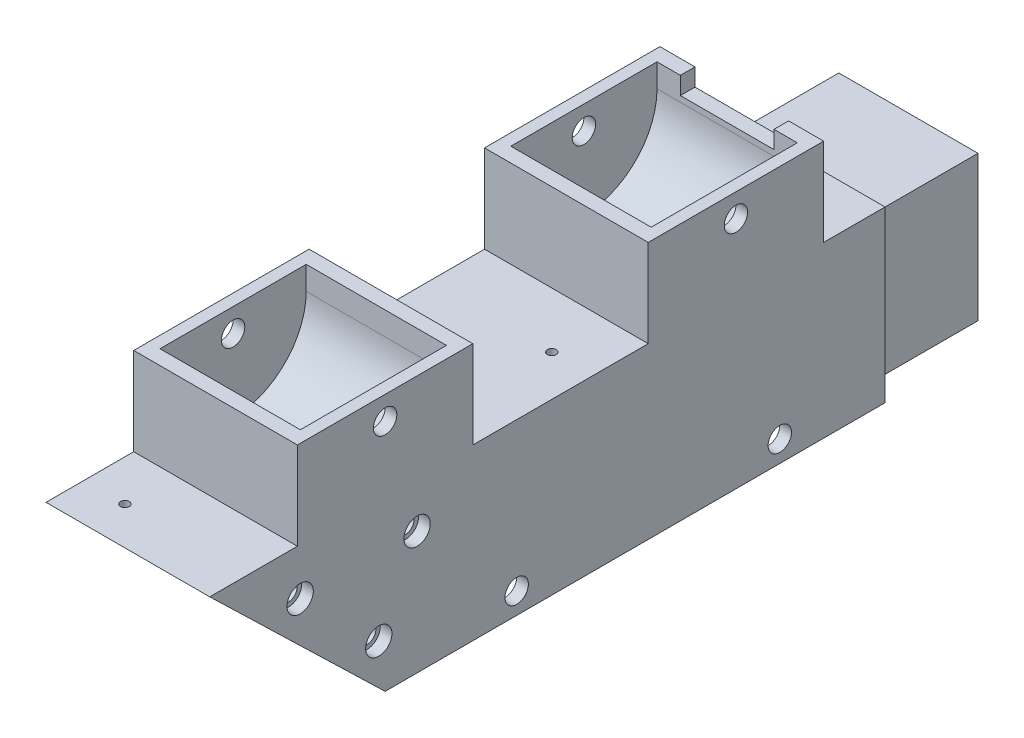
from build123d import *

# Parameters (mm, degrees)
SKETCH_1_W           = 250
SKETCH_1_H           = 29
SKETCH_1_W_2         = 30
SKETCH_1_H_2         = 15
EXTRUDE_1_DEPTH      = 28
SKETCH_1_3_R         = 2
CUT_EXTRUDE_1_DEPTH  = 132.450561049
CUT_EXTRUDE_START    = 2
SKETCH_1_5_R         = 2
CUT_EXTRUDE_2_DEPTH  = 24
SKETCH_3_W           = 6
SKETCH_3_H           = 19
EXTRUDE_2_DEPTH      = 35
SKETCH_3_3_W         = 6
SKETCH_3_3_H         = 19
EXTRUDE_3_DEPTH      = 35
SKETCH_1_6_R         = 2
CUT_EXTRUDE_3_DEPTH  = 166.088612569
CUT_EXTRUDE_7_REACH  = 167.089
SKETCH_1_8_R         = 3.1
FILLET_1_R           = 9.5
FILLET_2_R           = 5
SKETCH_4_R           = 5.1
CUT_EXTRUDE_4_DEPTH  = 31.5
SKETCH_4_2_OUTSIDE_W = 87.946
SKETCH_4_2_OUTSIDE_H = 103.946
SKETCH_4_2_OUTSIDE_R = 5.1
CUT_EXTRUDE_5_DEPTH  = 21.5
SKETCH_5_OUTSIDE_W   = 83.722
SKETCH_5_OUTSIDE_H   = 99.722
SKETCH_5_OUTSIDE_W_2 = 23.8
SKETCH_5_OUTSIDE_H_2 = 24.8
CUT_EXTRUDE_6_DEPTH  = 18
SKETCH_6_R           = 0.75
CUT_EXTRUDE_8_DEPTH  = 4
SKETCH_7_R           = 0.75
CUT_EXTRUDE_9_DEPTH  = 4
SKETCH_8_R           = 0.75
CUT_EXTRUDE_10_DEPTH = 4
SKETCH_9_R           = 0.75
CUT_EXTRUDE_11_DEPTH = 4
SKETCH_11_R          = 0.75
CUT_EXTRUDE_12_DEPTH = 166.088612569
CUT_EXTRUDE_13_DEPTH = 166.088612569
CUT_EXTRUDE_START_2  = 30
SKETCH_13_W          = 20.2
SKETCH_13_H          = 21.2
CUT_EXTRUDE_14_DEPTH = 40
SKETCH_11_5_R        = 1.5
CUT_EXTRUDE_18_DEPTH = 112.204766085
SKETCH_11_6_R        = 2.25
CUT_EXTRUDE_19_DEPTH = 2
CUT_EXTRUDE_START_3  = 26
SKETCH_11_7_R        = 2.25
CUT_EXTRUDE_20_DEPTH = 2
SKETCH_15_W          = 16
SKETCH_15_H          = 2.5
SKETCH_15_H_2        = 10
CUT_EXTRUDE_21_DEPTH = 3


with BuildPart() as part:
    # 草图1 → 凸台-拉伸1 (new body)
    with BuildSketch(Plane(origin=(0, 0, 0), x_dir=(0, 0, -1), z_dir=(1, 0, 0))):
        Rectangle(SKETCH_1_W, SKETCH_1_H)
        with Locations((-60, 22)):
            Rectangle(SKETCH_1_W_2, SKETCH_1_H_2)
        with Locations((0, 22)):
            Rectangle(SKETCH_1_W_2, SKETCH_1_H_2)
        with Locations((60, 22)):
            Rectangle(SKETCH_1_W_2, SKETCH_1_H_2)
    extrude(amount=EXTRUDE_1_DEPTH)

    # 草图1<3> → 切除-拉伸1 (cut, through all)
    with BuildSketch(Plane(origin=(0, 0, 0), x_dir=(0, 0, -1), z_dir=(1, 0, 0))):
        with Locations((-67.5, -10.858617882)):
            Circle(SKETCH_1_3_R)
        with Locations((-22.5, -10.858617882)):
            Circle(SKETCH_1_3_R)
        with Locations((22.5, -10.858617882)):
            Circle(SKETCH_1_3_R)
        with Locations((-60, 25.5)):
            Circle(SKETCH_1_3_R)
        with Locations((67.5, -10.858617882)):
            Circle(SKETCH_1_3_R)
        with Locations((0, 25.5)):
            Circle(SKETCH_1_3_R)
        with Locations((60, 25.5)):
            Circle(SKETCH_1_3_R)
    extrude(amount=CUT_EXTRUDE_1_DEPTH, mode=Mode.SUBTRACT)

    # 草图1<5> → 切除-拉伸2 (cut)
    # profile 1 of 7: a face of its own
    with BuildSketch(Plane(origin=(0, 0, 0), x_dir=(0, 0, -1), z_dir=(1, 0, 0)).offset(CUT_EXTRUDE_START)):
        with BuildLine():
            Line((-72.5, 29.5), (-72.5, 25.5))
            ThreePointArc((-72.5, 25.5), (-60, 13), (-47.5, 25.5))
            Line((-47.5, 25.5), (-47.5, 29.5))
            Line((-47.5, 29.5), (-72.5, 29.5))
        make_face()
        with Locations((-60, 25.5)):
            Circle(SKETCH_1_5_R, mode=Mode.SUBTRACT)
    # profile 2 of 7: a face of its own
    with BuildSketch(Plane(origin=(0, 0, 0), x_dir=(0, 0, -1), z_dir=(1, 0, 0)).offset(CUT_EXTRUDE_START)):
        with BuildLine():
            Line((-79.457856675, -14.5), (-55.542143325, -14.5))
            ThreePointArc((-55.542143325, -14.5), (-67.5, 1.641382118), (-79.457856675, -14.5))
        make_face()
        with Locations((-67.5, -10.858617882)):
            Circle(SKETCH_1_5_R, mode=Mode.SUBTRACT)
    # profile 3 of 7: a face of its own
    with BuildSketch(Plane(origin=(0, 0, 0), x_dir=(0, 0, -1), z_dir=(1, 0, 0)).offset(CUT_EXTRUDE_START)):
        with BuildLine():
            Line((-34.457856675, -14.5), (-10.542143325, -14.5))
            ThreePointArc((-10.542143325, -14.5), (-22.5, 1.641382118), (-34.457856675, -14.5))
        make_face()
        with Locations((-22.5, -10.858617882)):
            Circle(SKETCH_1_5_R, mode=Mode.SUBTRACT)
    # profile 4 of 7: a face of its own
    with BuildSketch(Plane(origin=(0, 0, 0), x_dir=(0, 0, -1), z_dir=(1, 0, 0)).offset(CUT_EXTRUDE_START)):
        with BuildLine():
            ThreePointArc((-12.5, 25.5), (0, 13), (12.5, 25.5))
            Line((12.5, 25.5), (12.5, 29.5))
            Line((12.5, 29.5), (-12.5, 29.5))
            Line((-12.5, 29.5), (-12.5, 25.5))
        make_face()
        with Locations((0, 25.5)):
            Circle(SKETCH_1_5_R, mode=Mode.SUBTRACT)
    # profile 5 of 7: a face of its own
    with BuildSketch(Plane(origin=(0, 0, 0), x_dir=(0, 0, -1), z_dir=(1, 0, 0)).offset(CUT_EXTRUDE_START)):
        with BuildLine():
            Line((10.542143325, -14.5), (34.457856675, -14.5))
            ThreePointArc((34.457856675, -14.5), (22.5, 1.641382118), (10.542143325, -14.5))
        make_face()
        with Locations((22.5, -10.858617882)):
            Circle(SKETCH_1_5_R, mode=Mode.SUBTRACT)
    # profile 6 of 7: a face of its own
    with BuildSketch(Plane(origin=(0, 0, 0), x_dir=(0, 0, -1), z_dir=(1, 0, 0)).offset(CUT_EXTRUDE_START)):
        with BuildLine():
            Line((55.542143325, -14.5), (79.457856675, -14.5))
            ThreePointArc((79.457856675, -14.5), (67.5, 1.641382118), (55.542143325, -14.5))
        make_face()
        with Locations((67.5, -10.858617882)):
            Circle(SKETCH_1_5_R, mode=Mode.SUBTRACT)
    # profile 7 of 7: a face of its own
    with BuildSketch(Plane(origin=(0, 0, 0), x_dir=(0, 0, -1), z_dir=(1, 0, 0)).offset(CUT_EXTRUDE_START)):
        with BuildLine():
            ThreePointArc((47.5, 25.5), (60, 13), (72.5, 25.5))
            Line((72.5, 25.5), (72.5, 29.5))
            Line((72.5, 29.5), (47.5, 29.5))
            Line((47.5, 29.5), (47.5, 25.5))
        make_face()
        with Locations((60, 25.5)):
            Circle(SKETCH_1_5_R, mode=Mode.SUBTRACT)
    extrude(amount=CUT_EXTRUDE_2_DEPTH, mode=Mode.SUBTRACT)

    # 草图3 → 凸台-拉伸2 (add)
    with BuildSketch(Plane.XY.offset(125)):
        with Locations((25, 0)):
            Rectangle(SKETCH_3_W, SKETCH_3_H)
    extrude(amount=EXTRUDE_2_DEPTH)

    # 草图3<3> → 凸台-拉伸3 (add)
    with BuildSketch(Plane.XY.offset(125)):
        with Locations((25, 0)):
            Rectangle(SKETCH_3_3_W, SKETCH_3_3_H)
        with Locations((3, 0)):
            Rectangle(SKETCH_3_3_W, SKETCH_3_3_H)
    extrude(amount=EXTRUDE_3_DEPTH)

    # 草图1<6> → 切除-拉伸3 (cut, through all)
    with BuildSketch(Plane(origin=(0, 0, 0), x_dir=(0, 0, -1), z_dir=(1, 0, 0))):
        with Locations(Location((-150, 0, 0), (0, 0, 90))):
            Circle(SKETCH_1_6_R)
    extrude(amount=CUT_EXTRUDE_3_DEPTH, mode=Mode.SUBTRACT)

    # 草图1<8> → 切除-拉伸7 (cut, up to next)
    with BuildSketch(Plane(origin=(0, 0, 0), x_dir=(0, 0, -1), z_dir=(1, 0, 0)), mode=Mode.PRIVATE) as cut_extrude_7_sk1:
        with Locations(Location((-150, 0, 0), (0, 0, 180))):
            Circle(SKETCH_1_8_R)
    cut_extrude_7_tool1 = extrude(cut_extrude_7_sk1.sketch, amount=CUT_EXTRUDE_7_REACH, mode=Mode.PRIVATE) & part.part
    add(cut_extrude_7_tool1.solids().sort_by_distance((0, 0, 150))[0], mode=Mode.SUBTRACT)

    # 圆角1
    fillet_1_edges = [part.edges().sort_by_distance(p)[0] for p in [
        (25, 9.5, 160),
        (25, -9.5, 160),
        (3, -9.5, 160),
        (3, 9.5, 160),
    ]]
    fillet(fillet_1_edges, radius=FILLET_1_R - 0.0001)  # a hair under: the kernel refuses the full size

    # 圆角2
    fillet_2_edges = [part.edges().sort_by_distance(p)[0] for p in [
        (14, -14.5, 125),
        (14, 14.5, 125),
    ]]
    fillet(fillet_2_edges, radius=FILLET_2_R)

    # 草图4 → 切除-拉伸4 (cut)
    with BuildSketch(Plane(origin=(0, 0, -125), x_dir=(-1, 0, 0), z_dir=(0, 0, -1))):
        with Locations((-14, 0)):
            Circle(SKETCH_4_R)
    extrude(amount=-CUT_EXTRUDE_4_DEPTH, mode=Mode.SUBTRACT)

    # 草图4<2> outside → 切除-拉伸5 (cut)
    with BuildSketch(Plane(origin=(0, 0, -125), x_dir=(-1, 0, 0), z_dir=(0, 0, -1))):
        with Locations((-14, 7.5)):
            Rectangle(SKETCH_4_2_OUTSIDE_W, SKETCH_4_2_OUTSIDE_H)
        with Locations((-14, 0)):
            Circle(SKETCH_4_2_OUTSIDE_R, mode=Mode.SUBTRACT)
    extrude(amount=-CUT_EXTRUDE_5_DEPTH, mode=Mode.SUBTRACT)

    # 草图5 outside → 切除-拉伸6 (cut)
    with BuildSketch(Plane(origin=(0, 0, -103.5), x_dir=(-1, 0, 0), z_dir=(0, 0, -1))):
        with Locations((-14, 7.5)):
            Rectangle(SKETCH_5_OUTSIDE_W, SKETCH_5_OUTSIDE_H)
        with Locations((-14, 0)):
            Rectangle(SKETCH_5_OUTSIDE_W_2, SKETCH_5_OUTSIDE_H_2, mode=Mode.SUBTRACT)
    extrude(amount=-CUT_EXTRUDE_6_DEPTH, mode=Mode.SUBTRACT)

    # 草图6 → 切除-拉伸8 (cut)
    with BuildSketch(Plane(origin=(0, 14.5, 0), x_dir=(1, 0, 0), z_dir=(0, 1, 0))):
        with Locations(Location((7, 23.5, 0), (0, 0, 270))):
            Circle(SKETCH_6_R)
        with Locations(Location((21, 35.5, 0), (0, 0, 270))):
            Circle(SKETCH_6_R)
        with Locations(Location((7, -23.5, 0), (0, 0, 270))):
            Circle(SKETCH_6_R)
        with Locations(Location((21, -35.5, 0), (0, 0, 270))):
            Circle(SKETCH_6_R)
    extrude(amount=-CUT_EXTRUDE_8_DEPTH, mode=Mode.SUBTRACT)

    # 草图7 → 切除-拉伸9 (cut)
    with BuildSketch(Plane(origin=(0, 14.5, 0), x_dir=(1, 0, 0), z_dir=(0, 1, 0))):
        with Locations(Location((7, -89.5, 0), (0, 0, 270))):
            Circle(SKETCH_7_R)
        with Locations(Location((21.2, -110.5, 0), (0, 0, 270))):
            Circle(SKETCH_7_R)
    extrude(amount=-CUT_EXTRUDE_9_DEPTH, mode=Mode.SUBTRACT)

    # 草图8 → 切除-拉伸10 (cut)
    with BuildSketch(Plane.ZY):
        with Locations((47, 4)):
            Circle(SKETCH_8_R)
        with Locations((2.499047641, -1.5)):
            Circle(SKETCH_8_R)
    extrude(amount=-CUT_EXTRUDE_10_DEPTH, mode=Mode.SUBTRACT)

    # 草图9 → 切除-拉伸11 (cut)
    with BuildSketch(Plane(origin=(28, 0, 0), x_dir=(0, 0, -1), z_dir=(1, 0, 0))):
        with Locations((-107.5, -0.5)):
            Circle(SKETCH_9_R)
        with Locations((-92.5, -0.5)):
            Circle(SKETCH_9_R)
    extrude(amount=-CUT_EXTRUDE_11_DEPTH, mode=Mode.SUBTRACT)

    # 草图11 → 切除-拉伸12 (cut, through all)
    with BuildSketch(Plane(origin=(0, 0, 0), x_dir=(0, 0, -1), z_dir=(1, 0, 0))):
        with Locations((-14.530122053, 6.5)):
            Circle(SKETCH_11_R)
        with Locations((-1.081846191, -6.5)):
            Circle(SKETCH_11_R)
        with Locations((5.469877947, 6.5)):
            Circle(SKETCH_11_R)
    extrude(amount=CUT_EXTRUDE_12_DEPTH, mode=Mode.SUBTRACT)

    # 草图10 → 切除-拉伸13 (cut, through all)
    with BuildSketch(Plane.ZY):
        Polygon((30, 14.5), (0, -14.5), (0, -65.636075395), (207.45026546, -65.636075395), (207.45026546, 45.542128626), (30, 45.542128626), align=None)
    extrude(amount=-CUT_EXTRUDE_13_DEPTH, mode=Mode.SUBTRACT)

    # 草图13 → 切除-拉伸14 (cut)
    with BuildSketch(Plane.XY.offset(CUT_EXTRUDE_START_2)):
        with Locations((14, 0)):
            Rectangle(SKETCH_13_W, SKETCH_13_H)
    extrude(amount=-CUT_EXTRUDE_14_DEPTH, mode=Mode.SUBTRACT)

    # 草图11<5> → 切除-拉伸18 (cut, through all)
    with BuildSketch(Plane(origin=(0, 0, 0), x_dir=(0, 0, -1), z_dir=(1, 0, 0))):
        with Locations(Location((-14.530122053, 6.5, 0), (0, 0, 90))):
            Circle(SKETCH_11_5_R)
        with Locations(Location((-1.081846191, -6.5, 0), (0, 0, 90))):
            Circle(SKETCH_11_5_R)
        with Locations(Location((5.469877947, 6.5, 0), (0, 0, 90))):
            Circle(SKETCH_11_5_R)
    extrude(amount=CUT_EXTRUDE_18_DEPTH, mode=Mode.SUBTRACT)

    # 草图11<6> → 切除-拉伸19 (cut)
    with BuildSketch(Plane(origin=(0, 0, 0), x_dir=(0, 0, -1), z_dir=(1, 0, 0))):
        with Locations((-14.530122053, 6.5)):
            Circle(SKETCH_11_6_R)
        with Locations((-1.081846191, -6.5)):
            Circle(SKETCH_11_6_R)
        with Locations((5.469877947, 6.5)):
            Circle(SKETCH_11_6_R)
    extrude(amount=CUT_EXTRUDE_19_DEPTH, mode=Mode.SUBTRACT)

    # 草图11<7> → 切除-拉伸20 (cut)
    with BuildSketch(Plane(origin=(0, 0, 0), x_dir=(0, 0, -1), z_dir=(1, 0, 0)).offset(CUT_EXTRUDE_START_3)):
        with Locations((-14.530122053, 6.5)):
            Circle(SKETCH_11_7_R)
        with Locations((-1.081846191, -6.5)):
            Circle(SKETCH_11_7_R)
        with Locations((5.469877947, 6.5)):
            Circle(SKETCH_11_7_R)
    extrude(amount=CUT_EXTRUDE_20_DEPTH, mode=Mode.SUBTRACT)

    # 草图15 → 切除-拉伸21 (cut)
    with BuildSketch(Plane(origin=(0, 29.5, 0), x_dir=(1, 0, 0), z_dir=(0, 1, 0))):
        with Locations((14, 73.75)):
            Rectangle(SKETCH_15_W, SKETCH_15_H)
        with Locations((14, 71.25)):
            Rectangle(SKETCH_15_W, SKETCH_15_H)
        with Locations((14, 65)):
            Rectangle(SKETCH_15_W, SKETCH_15_H_2)
    extrude(amount=-CUT_EXTRUDE_21_DEPTH, mode=Mode.SUBTRACT)


solid = part.part
